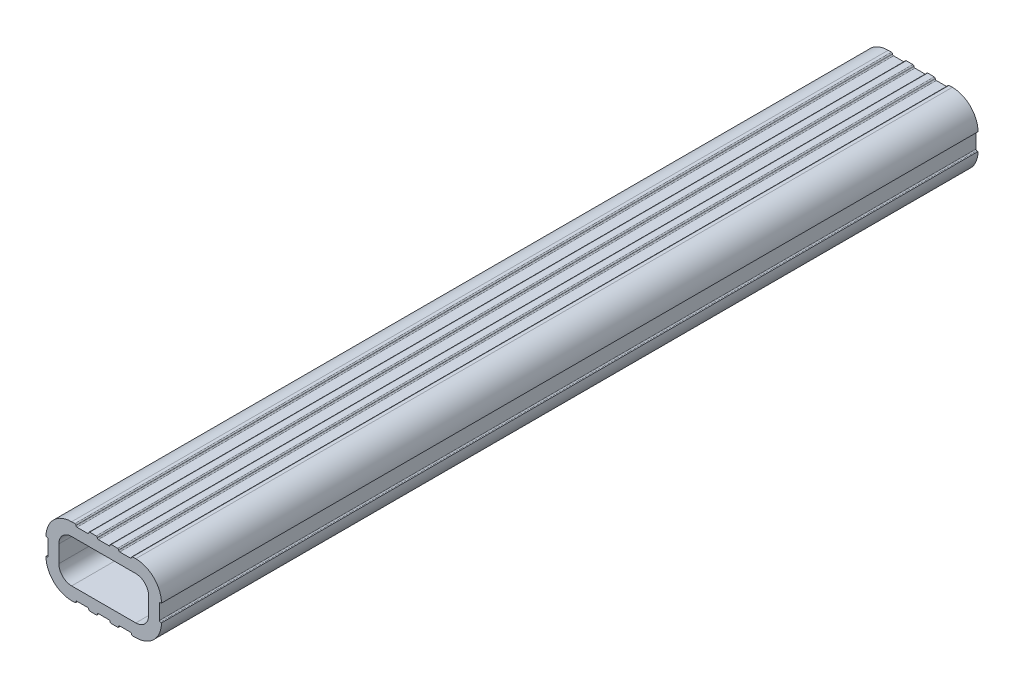
from build123d import *

# Parameters (mm, degrees)
BOSS_EXTRUDE1_DEPTH = 191
SKETCH2_W           = 3
SKETCH2_H           = 1
SKETCH2_W_2         = 1
SKETCH2_H_2         = 4
CUT_EXTRUDE1_DEPTH  = 193.59023859
FILLET1_R           = 0.25


with BuildPart() as part:
    # Sketch1 → Boss-Extrude1 (new body)
    with BuildSketch(Plane.XY):
        with BuildLine():
            Line((0, 3), (-15, 3))
            ThreePointArc((-15, 3), (-19.242640687, 1.242640687), (-21, -3))
            Line((-21, -3), (-21, -7))
            ThreePointArc((-21, -7), (-19.242640687, -11.242640687), (-15, -13))
            Line((-15, -13), (0, -13))
            ThreePointArc((0, -13), (4.242640687, -11.242640687), (6, -7))
            Line((6, -7), (6, -3))
            ThreePointArc((6, -3), (4.242640687, 1.242640687), (0, 3))
        make_face()
        with BuildLine():
            Line((0, 0), (-15, 0))
            ThreePointArc((-15, 0), (-17.121320344, -0.878679656), (-18, -3))
            Line((-18, -3), (-18, -7))
            ThreePointArc((-18, -7), (-17.121320344, -9.121320344), (-15, -10))
            Line((-15, -10), (0, -10))
            ThreePointArc((0, -10), (2.121320344, -9.121320344), (3, -7))
            Line((3, -7), (3, -3))
            ThreePointArc((3, -3), (2.121320344, -0.878679656), (0, 0))
        make_face(mode=Mode.SUBTRACT)
    extrude(amount=BOSS_EXTRUDE1_DEPTH)

    # Sketch2 → Cut-Extrude1 (cut, through all)
    with BuildSketch(Plane.XY.offset(191)):
        with Locations((-7.5, 3)):
            Rectangle(SKETCH2_W, SKETCH2_H)
        with Locations((-12.5, 3)):
            Rectangle(SKETCH2_W, SKETCH2_H)
        with Locations((-2.5, 3)):
            Rectangle(SKETCH2_W, SKETCH2_H)
        with Locations((-2.5, -13)):
            Rectangle(SKETCH2_W, SKETCH2_H)
        with Locations((-12.5, -13)):
            Rectangle(SKETCH2_W, SKETCH2_H)
        with Locations((-7.5, -13)):
            Rectangle(SKETCH2_W, SKETCH2_H)
        with Locations((6, -5)):
            Rectangle(SKETCH2_W_2, SKETCH2_H_2)
        with Locations((-21, -5)):
            Rectangle(SKETCH2_W_2, SKETCH2_H_2)
    extrude(amount=-CUT_EXTRUDE1_DEPTH, mode=Mode.SUBTRACT)

    # Fillet1
    fillet1_edges = [part.edges().sort_by_distance(p)[0] for p in [
        (-20.5, -7, 95.5),
        (-20.5, -3, 95.5),
        (-14, -13, 95.5),
        (-11, -12.5, 95.5),
        (-6, -12.5, 95.5),
        (-11, -13, 95.5),
        (-9, -13, 95.5),
        (-6, -13, 95.5),
        (-4, -13, 95.5),
        (-14, -12.5, 95.5),
        (-9, -12.5, 95.5),
        (-1, -13, 95.5),
        (-1, -12.5, 95.5),
        (5.5, -7, 95.5),
        (-4, -12.5, 95.5),
        (5.5, -3, 95.5),
        (-1, 3, 95.5),
        (-4, 3, 95.5),
        (-6, 3, 95.5),
        (-14, 3, 95.5),
        (-11, 3, 95.5),
        (-9, 3, 95.5),
        (-1, 2.5, 95.5),
        (-4, 2.5, 95.5),
        (-6, 2.5, 95.5),
        (-9, 2.5, 95.5),
        (-11, 2.5, 95.5),
        (-14, 2.5, 95.5),
    ]]
    fillet(fillet1_edges, radius=FILLET1_R - 0.0001)  # a hair under: the kernel refuses the full size


solid = part.part
